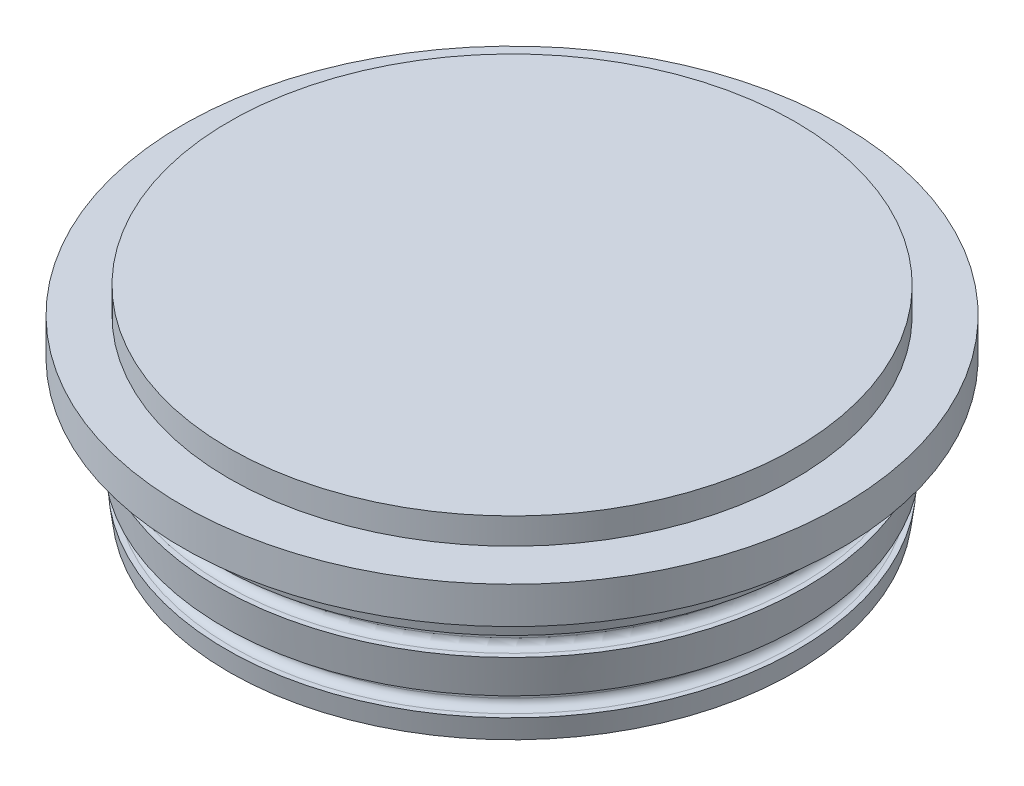
from build123d import *

# Parameters (mm, degrees)
CONG_1_R                     = 1.5
CONG_2_R                     = 10
TROU_TARAUD_M4X0_71_D        = 3.3
TROU_TARAUD_M4X0_71_DEPTH    = 18.5
R_P_TITION_CIRCULAIRE2_COUNT = 4


with BuildPart() as part:
    # Esquisse1 → Révolution1 (revolve)
    with BuildSketch(Plane.XY):
        Polygon((57.29131244, -7), (62.9, -7), (62.9, 0), (54, 0), (54, 5), (0, 5), (0, 0), (0, -6.5), (46, -6.5), (46, -32), (54, -32), (54.52660999, -28), (52.053219981, -28), (52.053219981, -24), (55.053219981, -24), (55.974787464, -17), (53.501397454, -17), (53.501397454, -13), (56.501397454, -13), align=None)
    revolve(axis=Axis((0, 0, 0), (0, 1, 0)))

    # Congé1
    cong_1_edges = [part.edges().sort_by_distance(p)[0] for p in [
        (-53.501397454, -17, 0),
        (-52.053219981, -28, 0),
        (-52.053219981, -24, 0),
        (-53.501397454, -13, 0),
    ]]
    fillet(cong_1_edges, radius=CONG_1_R)

    # Congé2
    cong_2_edges = [part.edges().sort_by_distance(p)[0] for p in [
        (-46, -6.5, 0),
    ]]
    fillet(cong_2_edges, radius=CONG_2_R)

    # Trou taraudé M4x0.71
    with Locations(Plane.XZ.offset(32)):
        with Locations((50, 0)):
            trou_taraud_m4x0_71 = Hole(TROU_TARAUD_M4X0_71_D / 2, depth=TROU_TARAUD_M4X0_71_DEPTH)

    # Répétition circulaire2: Trou taraudé M4x0.71 ×4 about axis
    r_p_tition_circulaire2_axis = Axis((0, -16.5, 0), (0, 1, 0))
    for i in range(1, R_P_TITION_CIRCULAIRE2_COUNT):
        add(trou_taraud_m4x0_71.rotate(r_p_tition_circulaire2_axis, i * 360 / R_P_TITION_CIRCULAIRE2_COUNT), mode=Mode.SUBTRACT)


solid = part.part
